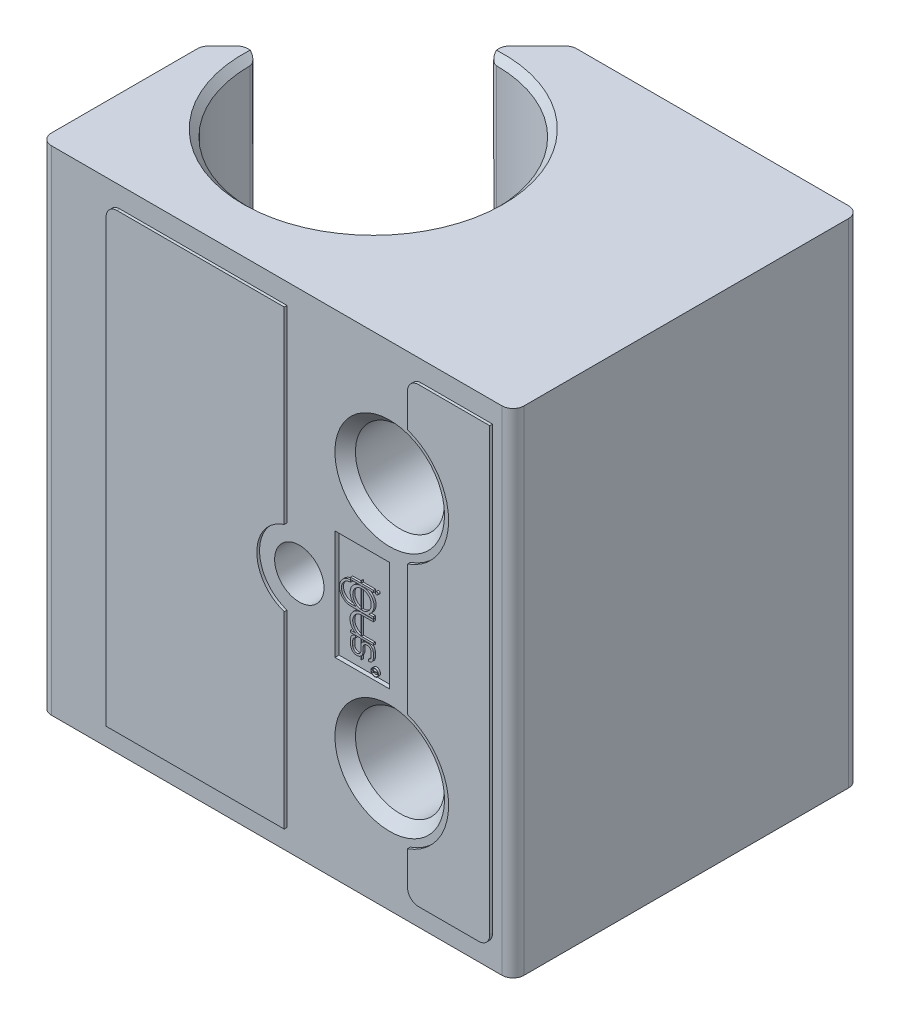
from build123d import *

# Parameters (mm, degrees)
BOSS_EXTRUDE1_DEPTH = 16.2
BOSS_EXTRUDE2_DEPTH = 3.6
BOSS_EXTRUDE3_DEPTH = 16.2
HOLE1_D             = 18
BOSS_EXTRUDE4_DEPTH = 0.2
BOSS_EXTRUDE5_DEPTH = 0.2
SKETCH8_W           = 4
SKETCH8_H           = 8
CUT_EXTRUDE1_DEPTH  = 0.3
SKETCH9_R           = 0.275
BOSS_EXTRUDE6_DEPTH = 0.15
HOLE2_D             = 0.5
BOSS_EXTRUDE7_DEPTH = 0.15
CUT_EXTRUDE2_DEPTH  = 0.15
BOSS_EXTRUDE8_DEPTH = 0.15
CUT_EXTRUDE3_START  = -0.15
CUT_EXTRUDE3_DEPTH  = 0.15
CUT_EXTRUDE4_DEPTH  = 0.15
CUT_EXTRUDE5_DEPTH  = 0.15
DRAFT1_ANGLE        = 29.744881332
SKETCH18_W          = 0.1
SKETCH18_H          = 0.15
HOLE3_AT_2_COUNT    = 2
HOLE3_AT_2_PITCH    = 18
SKETCH21_W          = 1.8
SKETCH21_H          = 12.8
CHAMFER1_SIZE       = 0.75
CHAMFER2_SIZE       = 0.5
FILLET1_R           = 0.5
FILLET2_R           = 0.799999993


with BuildPart() as part:
    # Sketch1 → Boss-Extrude1 (new body)
    with BuildSketch(Plane(origin=(0, 80.199, 0), x_dir=(1, 0, 0), z_dir=(0, 1, 0))):
        with BuildLine():
            Line((28.5, 30.99999999), (28.5, 29.986100378))
            ThreePointArc((28.5, 29.986100378), (35.363961031, 14.636038969), (20.013899622, 21.5))
            Line((20.013899622, 21.5), (19.00000001, 21.5))
            Line((19.00000001, 21.5), (17.5, 19.99999999))
            Line((17.5, 19.99999999), (17.5, 8.2))
            Line((17.5, 8.2), (52, 8.2))
            Line((52, 8.2), (52, 33.5))
            Line((52, 33.5), (31.00000001, 33.5))
            Line((31.00000001, 33.5), (28.5, 30.99999999))
        make_face()
    extrude(amount=-BOSS_EXTRUDE1_DEPTH)

    # Sketch2 → Boss-Extrude2 (add)
    with BuildSketch(Plane(origin=(0, 80.199, 0), x_dir=(-1, 0, 0), z_dir=(0, 1, 0))):
        with BuildLine():
            Line((-28.5, -30.987492178), (-28.5, -30.99999999))
            Line((-28.5, -30.99999999), (-31.00000001, -33.5))
            Line((-31.00000001, -33.5), (-52, -33.5))
            Line((-52, -33.5), (-52, -8.2))
            Line((-52, -8.2), (-17.5, -8.2))
            Line((-17.5, -8.2), (-17.5, -19.99999999))
            Line((-17.5, -19.99999999), (-19.00000001, -21.5))
            Line((-19.00000001, -21.5), (-19.012507822, -21.5))
            ThreePointArc((-19.012507822, -21.5), (-36.071067812, -13.928932188), (-28.5, -30.987492178))
        make_face()
    extrude(amount=BOSS_EXTRUDE2_DEPTH)

    # Sketch3 → Boss-Extrude3 (add)
    with BuildSketch(Plane(origin=(0, 83.799, 0), x_dir=(-1, 0, 0), z_dir=(0, 1, 0))):
        Polygon((-28.5, -21.5), (-28.5, -30.99999999), (-31.00000001, -33.5), (-52, -33.5), (-52, -8.2), (-17.5, -8.2), (-17.5, -19.99999999), (-19.00000001, -21.5), align=None)
    extrude(amount=BOSS_EXTRUDE3_DEPTH)

    # Hole1 (through all)
    with Locations(Plane(origin=(0, 83.799, 0), x_dir=(-1, 0, 0), z_dir=(0, -1, 0))):
        with Locations((-29, 21)):
            Hole(HOLE1_D / 2)

    # Sketch6 → Boss-Extrude4 (add)
    with BuildSketch(Plane.XY.offset(-8.2)):
        with BuildLine():
            Line((44.5, 98.49900001), (50.5, 98.49900001))
            Line((50.5, 98.49900001), (50.5, 65.49900001))
            Line((50.5, 65.49900001), (44.5, 65.49900001))
            Line((44.5, 65.49900001), (44.5, 68.756359311))
            ThreePointArc((44.5, 68.756359311), (47.500000002, 72.999), (44.5, 77.24164069))
            Line((44.5, 77.24164069), (44.5, 86.756359321))
            ThreePointArc((44.5, 86.756359321), (47.500000002, 90.99900001), (44.5, 95.2416407))
            Line((44.5, 95.2416407), (44.5, 98.49900001))
        make_face()
    extrude(amount=BOSS_EXTRUDE4_DEPTH)

    # Sketch7 → Boss-Extrude5 (add)
    with BuildSketch(Plane.XY.offset(-8.2)):
        with BuildLine():
            Line((35.5, 65.499), (22.5, 65.499))
            Line((22.5, 65.499), (22.5, 98.499))
            Line((22.5, 98.499), (35.5, 98.499))
            Line((35.5, 98.499), (35.5, 84.75580975))
            ThreePointArc((35.5, 84.75580975), (33.5, 81.999), (35.5, 79.24219025))
            Line((35.5, 79.24219025), (35.5, 65.499))
        make_face()
    extrude(amount=BOSS_EXTRUDE5_DEPTH)

    # Sketch8 → Cut-Extrude1 (cut)
    with BuildSketch(Plane.XY.offset(-8.2)):
        with Locations((41, 81.999)):
            Rectangle(SKETCH8_W, SKETCH8_H)
    extrude(amount=-CUT_EXTRUDE1_DEPTH, mode=Mode.SUBTRACT)

    # Sketch9 → Boss-Extrude6 (add)
    with BuildSketch(Plane.XY.offset(-8.5)):
        with Locations((41.75, 78.349)):
            Circle(SKETCH9_R)
    extrude(amount=BOSS_EXTRUDE6_DEPTH)

    # Hole2 (through all)
    with Locations(Plane.XY.offset(-8.35)):
        with Locations((41.75, 78.349)):
            Hole(HOLE2_D / 2)

    # Sketch14 → Boss-Extrude8 (add)
    with BuildSketch(Plane.XY.offset(-8.5)):
        with BuildLine():
            Line((41.65, 80.149), (41.65, 79.999))
            Line((41.65, 79.999), (40.775, 79.999))
            Line((40.775, 79.999), (40.775, 79.699))
            ThreePointArc((40.775, 79.699), (40.953461463, 79.881865512), (41.2, 79.949))
            ThreePointArc((41.2, 79.949), (41.514813213, 79.850039864), (41.65, 79.549))
            Line((41.65, 79.549), (41.65, 79.174))
            ThreePointArc((41.65, 79.174), (41.547487373, 78.926512627), (41.3, 78.824))
            Line((41.3, 78.824), (41.3, 78.974))
            ThreePointArc((41.3, 78.974), (41.443847632, 79.063921894), (41.5, 79.224))
            Line((41.5, 79.224), (41.5, 79.499))
            ThreePointArc((41.5, 79.499), (41.2, 79.799), (40.9, 79.499))
            Line((40.9, 79.499), (40.9, 79.224))
            ThreePointArc((40.9, 79.224), (40.867582327, 79.056294902), (40.775, 78.91275251))
            Line((40.775, 78.91275251), (40.775, 78.649))
            Line((40.775, 78.649), (40.75, 78.649))
            Line((40.75, 78.649), (40.75, 78.888589803))
            ThreePointArc((40.75, 78.888589803), (40.266288269, 78.813208082), (40, 79.224))
            Line((40, 79.224), (40, 79.624))
            ThreePointArc((40, 79.624), (40.102512627, 79.871487373), (40.35, 79.974))
            Line((40.35, 79.974), (40.35, 79.824))
            ThreePointArc((40.35, 79.824), (40.206152368, 79.734078106), (40.15, 79.574))
            Line((40.15, 79.574), (40.15, 79.224))
            ThreePointArc((40.15, 79.224), (40.45, 78.924), (40.75, 79.224))
            Line((40.75, 79.224), (40.75, 79.999))
            Line((40.75, 79.999), (40, 79.999))
            Line((40, 79.999), (40, 80.149))
            Line((40, 80.149), (40.35, 80.149))
            ThreePointArc((40.35, 80.149), (39.973791265, 81.052655663), (40.75, 81.649))
            Line((40.75, 81.649), (40.75, 81.674))
            Line((40.75, 81.674), (40, 81.674))
            ThreePointArc((40, 81.674), (39.175, 82.499), (40, 83.324))
            Line((40, 83.324), (40, 83.174))
            ThreePointArc((40, 83.174), (39.325, 82.499), (40, 81.824))
            Line((40, 81.824), (40.4, 81.824))
            ThreePointArc((40.4, 81.824), (39.97985391, 82.712867421), (40.75, 83.324))
            Line((40.75, 83.324), (40.75, 83.349))
            Line((40.75, 83.349), (40, 83.349))
            Line((40, 83.349), (40, 83.499))
            Line((40, 83.499), (40.75, 83.499))
            Line((40.75, 83.499), (40.75, 83.649))
            Line((40.75, 83.649), (40.775, 83.649))
            Line((40.775, 83.649), (40.775, 83.499))
            Line((40.775, 83.499), (41.675, 83.499))
            Line((41.675, 83.499), (41.675, 83.349))
            Line((41.675, 83.349), (40.8, 83.349))
            Line((40.8, 83.349), (40.8, 83.324))
            ThreePointArc((40.8, 83.324), (41.662066059, 82.77802202), (41.3, 81.824))
            Line((41.3, 81.824), (41.65, 81.824))
            Line((41.65, 81.824), (41.65, 81.674))
            Line((41.65, 81.674), (40.775, 81.674))
            Line((40.775, 81.674), (40.775, 81.649))
            Line((40.775, 81.649), (41.65, 81.649))
            Line((41.65, 81.649), (41.65, 81.499))
            Line((41.65, 81.499), (40.775, 81.499))
            Line((40.775, 81.499), (40.775, 80.150848678))
            ThreePointArc((40.775, 80.150848678), (40.799982918, 80.149462327), (40.825, 80.149))
            Line((40.825, 80.149), (41.65, 80.149))
        make_face()
    extrude(amount=BOSS_EXTRUDE8_DEPTH)

    # Sketch15 → Cut-Extrude3 (cut)
    with BuildSketch(Plane.XY.offset(-8.35).offset(CUT_EXTRUDE3_START)):
        with BuildLine():
            Line((40.75, 80.153166667), (40.75, 81.499))
            ThreePointArc((40.75, 81.499), (40.147916667, 80.826083333), (40.75, 80.153166667))
        make_face()
    extrude(amount=CUT_EXTRUDE3_DEPTH, mode=Mode.SUBTRACT)

    # Sketch16 → Cut-Extrude4 (cut)
    with BuildSketch(Plane.XY.offset(-8.35)):
        with BuildLine():
            Line((40.75, 81.828179607), (40.75, 83.169820393))
            ThreePointArc((40.75, 83.169820393), (40.15, 82.499), (40.75, 81.828179607))
        make_face()
    extrude(amount=-CUT_EXTRUDE4_DEPTH, mode=Mode.SUBTRACT)

    # Sketch17 → Cut-Extrude5 (cut)
    with BuildSketch(Plane.XY.offset(-8.35)):
        with BuildLine():
            Line((40.775, 83.172145601), (40.775, 81.825854399))
            ThreePointArc((40.775, 81.825854399), (41.5, 82.499), (40.775, 83.172145601))
        make_face()
    extrude(amount=-CUT_EXTRUDE5_DEPTH, mode=Mode.SUBTRACT)

    # Sketch18 → Revolve1 (revolve)
    with BuildSketch(Plane.XZ.offset(-83.424), mode=Mode.PRIVATE) as revolve1_sk:
        with Locations((41.95, -8.425)):
            Rectangle(SKETCH18_W, SKETCH18_H)
    revolve(revolve1_sk.sketch.rotate(Axis((41.9, 83.424, -8.35), (0, 0, -1)), 180), axis=Axis((41.9, 83.424, -8.35), (0, 0, -1)))

    # Sketch19 → Hole3 (revolve, cut)
    with BuildSketch(Plane(origin=(43, 72.999, -33.5), x_dir=(0, 1, 0), z_dir=(1, 0, 0))):
        Polygon((0, 0), (0, 25.301), (3.25, 25.301), (3.25, 4), (6.5, 4), (6.5, 0), align=None)
    hole3 = revolve(axis=Axis((43, 72.999, 76.5), (0, 0, -1)), mode=Mode.SUBTRACT)

    # Hole3 at 2: Hole3 ×2
    with Locations(*[(0, i * HOLE3_AT_2_PITCH, 0) for i in range(1, HOLE3_AT_2_COUNT)]):
        add(hole3, mode=Mode.SUBTRACT)

    # Sketch21 → #5 Clearance Hole1 (revolve, cut)
    with BuildSketch(Plane(origin=(36.4, 81.999, -8.2), x_dir=(0, -1, 0), z_dir=(1, 0, 0))):
        with Locations((0.9, 6.4)):
            Rectangle(SKETCH21_W, SKETCH21_H)
    revolve(axis=Axis((36.4, 81.999, -1.85), (0, 0, -1)), mode=Mode.SUBTRACT)

    # Chamfer1
    chamfer1_edges = [part.edges().sort_by_distance(p)[0] for p in [
        (43, 87.749, -8.2),
        (43, 87.749, -29.5),
        (43, 69.749, -29.5),
        (43, 69.749, -8.2),
    ]]
    chamfer(chamfer1_edges, length=CHAMFER1_SIZE)

    # Chamfer2
    chamfer2_edges = [part.edges().sort_by_distance(p)[0] for p in [
        (35.363961031, 63.999, -14.636038969),
        (35.363961031, 99.999, -14.636038969),
    ]]
    chamfer(chamfer2_edges, length=CHAMFER2_SIZE)

    # Fillet1
    fillet1_edges = [part.edges().sort_by_distance(p)[0] for p in [
        (28.5, 91.649, -29.986100378),
        (20.013899622, 91.649, -21.5),
        (28.5, 72.349, -29.986100378),
        (20.013899622, 72.349, -21.5),
    ]]
    fillet(fillet1_edges, radius=FILLET1_R)

    # Fillet2
    # the kernel refuses this fillet: 0.799999993 mm, written as the material it takes off along each edge
    with BuildSketch(Plane(origin=(22.5, 98.499, -8.2), x_dir=(0, -1, 0), z_dir=(0, 0, 1)), Plane(origin=(50.5, 65.49900001, -8.2), x_dir=(0, 1, 0), z_dir=(0, 0, 1)), Plane(origin=(44.5, 98.49900001, -8.2), x_dir=(0, -1, 0), z_dir=(0, 0, 1)), Plane(origin=(44.5, 65.49900001, -8.2), x_dir=(1, 0, 0), z_dir=(0, 0, 1))) as fillet2_piece_1:
        with BuildLine():
            CenterArc((FILLET2_R, FILLET2_R), FILLET2_R, 180, 90)
            Line((0, FILLET2_R), (0, 0))
            Line((0, 0), (FILLET2_R, 0))
        make_face()
    extrude(amount=2.199999983, mode=Mode.SUBTRACT)
    with BuildSketch(Plane(origin=(19.00000001, 63.170572883, -21.5), x_dir=(1, 0, 0), z_dir=(0, 1, 0)), Plane(origin=(17.5, 63.170572883, -19.99999999), x_dir=(0.7071067811865476, 0, -0.7071067811865476), z_dir=(0, 1, 0)), Plane(origin=(28.5, 100.827427117, -30.99999999), x_dir=(0, 0, 1), z_dir=(0, -1, 0)), Plane(origin=(31.00000001, 100.827427117, -33.5), x_dir=(-0.7071067811865476, 0, 0.7071067811865476), z_dir=(0, -1, 0))) as fillet2_piece_2:
        with BuildLine():
            CenterArc((FILLET2_R * 0.414213562373, -FILLET2_R), FILLET2_R, 90, 45)
            Line((-FILLET2_R * 0.292893218814, -FILLET2_R * 0.292893218814), (0, 0))
            Line((0, 0), (FILLET2_R * 0.414213562373, 0))
        make_face()
    extrude(amount=37.656854235, mode=Mode.SUBTRACT)
    with BuildSketch(Plane(origin=(17.5, 61.999000017, -8.2), x_dir=(1, 0, 0), z_dir=(0, 1, 0)), Plane(origin=(52, 61.999000017, -8.2), x_dir=(0, 0, -1), z_dir=(0, 1, 0)), Plane(origin=(52, 61.999000017, -33.5), x_dir=(-1, 0, 0), z_dir=(0, 1, 0))) as fillet2_piece_3:
        with BuildLine():
            CenterArc((FILLET2_R, FILLET2_R), FILLET2_R, 180, 90)
            Line((0, FILLET2_R), (0, 0))
            Line((0, 0), (FILLET2_R, 0))
        make_face()
    extrude(amount=39.999999965, mode=Mode.SUBTRACT)


with BuildPart() as body_2:
    # Sketch12 → Boss-Extrude7 (new body)
    with BuildSketch(Plane(origin=(0, 0, -8.5), x_dir=(-1, 0, 0), z_dir=(0, 0, -1))):
        with BuildLine():
            Line((-41.925, 78.424), (-41.925, 78.349))
            ThreePointArc((-41.925, 78.349), (-41.8375, 78.2615), (-41.75, 78.349))
            Line((-41.75, 78.349), (-41.75, 78.3615))
            Line((-41.75, 78.3615), (-41.575, 78.2615))
            Line((-41.575, 78.2615), (-41.574720796, 78.375896889))
            Line((-41.574720796, 78.375896889), (-41.75, 78.375896889))
            Line((-41.75, 78.375896889), (-41.75, 78.4115))
            Line((-41.75, 78.4115), (-41.575, 78.4115))
            Line((-41.575, 78.4115), (-41.575, 78.424))
            Line((-41.575, 78.424), (-41.925, 78.424))
        make_face()
    extrude(amount=-BOSS_EXTRUDE7_DEPTH)

    # Sketch13 → Cut-Extrude2 (cut)
    with BuildSketch(Plane.XY.offset(-8.35)):
        with BuildLine():
            Line((41.7625, 78.4115), (41.7625, 78.349))
            ThreePointArc((41.7625, 78.349), (41.8375, 78.274), (41.9125, 78.349))
            Line((41.9125, 78.349), (41.9125, 78.4115))
            Line((41.9125, 78.4115), (41.7625, 78.4115))
        make_face()
    extrude(amount=-CUT_EXTRUDE2_DEPTH, mode=Mode.SUBTRACT)

    # Draft1
    draft1_faces = [body_2.faces().sort_by_distance(p)[0] for p in [
        (41.662360398, 78.375896889, -8.425),
    ]]
    draft(draft1_faces, Plane(origin=(41.75, 78.375896889, -8.35), x_dir=(0, 0, -1), z_dir=(-1, 0, 0)), DRAFT1_ANGLE)


solid = Compound([part.part, body_2.part])
